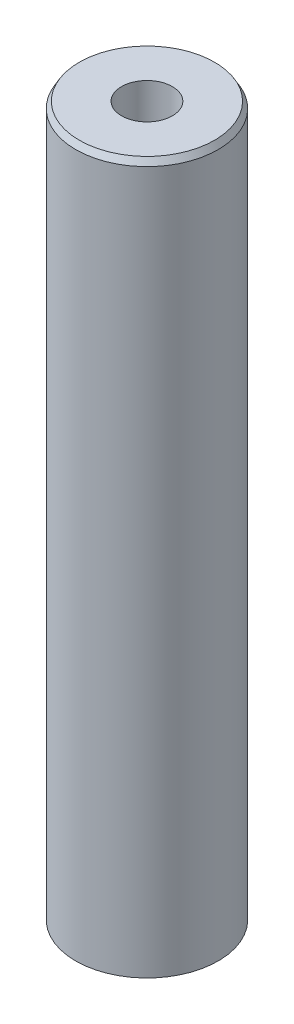
from build123d import *
from OCP.BRepFilletAPI import BRepFilletAPI_MakeChamfer

# Parameters (mm, degrees)
SKETCH1_R           = 60
BOSS_EXTRUDE1_DEPTH = 600
SKETCH2_R           = 21.381609721
CUT_EXTRUDE1_DEPTH  = 606.970296302
CHAMFER1_SIZE       = 5.290696036
CHAMFER1_SIZE2      = 3.05458478


with BuildPart() as part:
    # Sketch1 → Boss-Extrude1 (new body)
    with BuildSketch(Plane(origin=(0, 0, 0), x_dir=(1, 0, 0), z_dir=(0, 1, 0))):
        Circle(SKETCH1_R)
    extrude(amount=BOSS_EXTRUDE1_DEPTH)

    # Sketch2 → Cut-Extrude1 (cut, through all)
    with BuildSketch(Plane(origin=(0, 0, 0), x_dir=(1, 0, 0), z_dir=(0, 1, 0))):
        Circle(SKETCH2_R)
    extrude(amount=CUT_EXTRUDE1_DEPTH, mode=Mode.SUBTRACT)

    # Chamfer1: one chamfer whose edges measure the first distance from different faces: ONE call of the kernel's chamfer builder (chamfer() names one face for all edges)
    chamfer1_edges_1 = [part.edges().sort_by_distance(p)[0] for p in [
        (-60, 600, 0),
    ]]
    chamfer1_side_1 = [part.faces().sort_by_distance(p)[0] for p in [
        (-60, 300, 0),
    ]]
    chamfer1_edges_2 = [part.edges().sort_by_distance(p)[0] for p in [
        (-60, 0, 0),
    ]]
    chamfer1_side_2 = [part.faces().sort_by_distance(p)[0] for p in [
        (-58.302943725, 0, 0),
    ]]
    chamfer1 = BRepFilletAPI_MakeChamfer(part.part.solid().wrapped)
    for e in chamfer1_edges_1:
        chamfer1.Add(CHAMFER1_SIZE, CHAMFER1_SIZE2, e.wrapped, chamfer1_side_1[0].wrapped)  # the first distance lies on this face
    for e in chamfer1_edges_2:
        chamfer1.Add(CHAMFER1_SIZE, CHAMFER1_SIZE2, e.wrapped, chamfer1_side_2[0].wrapped)  # the first distance lies on this face
    add(Compound.cast(chamfer1.Shape()), mode=Mode.REPLACE)


solid = part.part
